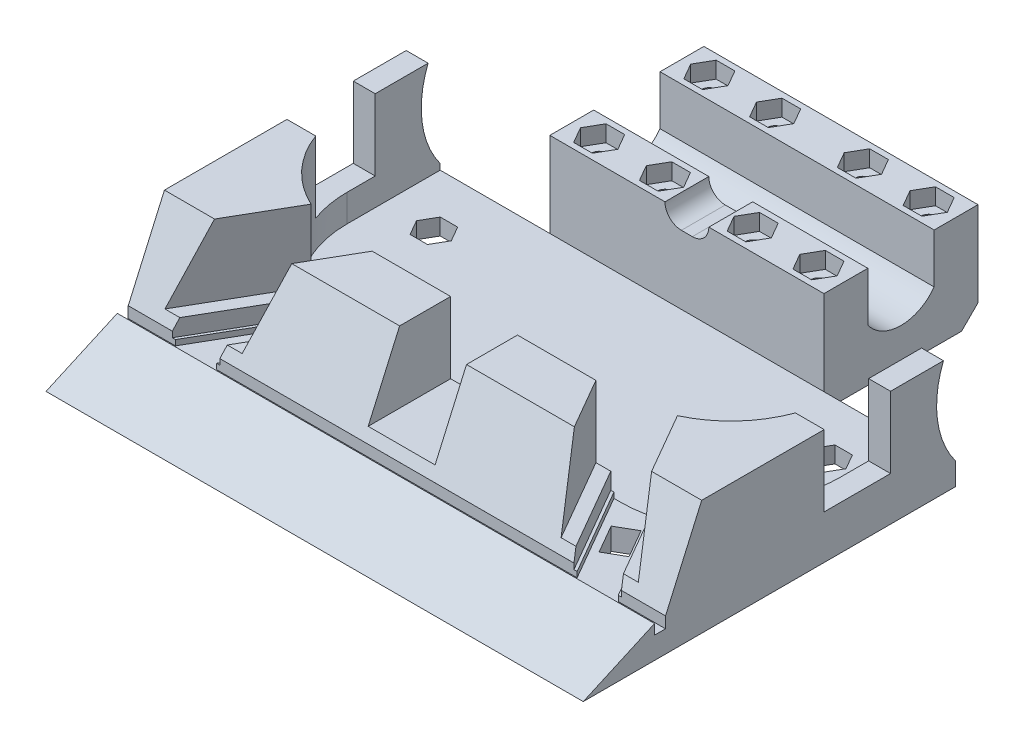
from build123d import *

# Parameters (mm, degrees)
BASE_DEPTH                                           = 3
CROQUIS3_W                                           = 50
CROQUIS3_H                                           = 28.1
MOTORES_DEPTH                                        = 15.5
CORTE_MOTORES_REACH                                  = 92.66
CABLES_MOTORES_REACH                                 = 87.753
REFRENTADO_PARA_TORNILLO_CON_CABEZA_TRON_D           = 2.8
REFRENTADO_PARA_TORNILLO_CON_CABEZA_TRON_DEPTH       = 19.490441672
REFRENTADO_PARA_TORNILLO_CON_CABEZA_TRON_CBORE_D     = 6
REFRENTADO_PARA_TORNILLO_CON_CABEZA_TRON_CBORE_DEPTH = 4
REFRENTADO_PARA_TORNILLO_CON_CABEZA_TRON_TIP         = 0.509558328
TUERCAS_DEPTH                                        = 3
MAT_TUERCAS_COUNT                                    = 2
MAT_TUERCAS_PITCH                                    = 20.1
SOBRESALIENTE_FRENTE_DEPTH                           = 1
CROQUIS17_W                                          = 49
CROQUIS17_H                                          = 13
SOBRESALIENTE_S_PISO_DEPTH                           = 4
CROQUIS18_W                                          = 4
CROQUIS18_H                                          = 11.85
SOPORTE_SENSORES_DEPTH                               = 13
RAMPA_DEPTH                                          = 49
SENSOR_PISO_REACH                                    = 74.409
CHAFL_N1_SIZE                                        = 3
CORTAR_EXTRUIR2_START                                = 1
CORTAR_EXTRUIR2_DEPTH                                = 3
CORTAR_EXTRUIR3_DEPTH                                = 10
CORTAR_EXTRUIR5_REACH                                = 74.409
ELIMINAR_START                                       = 33
ELIMINAR_CARA3_DEPTH                                 = 10
ELIMINAR_START_2                                     = -43
ELIMINAR_CARA4_DEPTH                                 = 10


# Read off the part's stored shape, not the designer's step: Eliminar cara3, Eliminar cara4
with BuildPart() as part:
    # Croquis2 → BASE (new body)
    with BuildSketch(Plane(origin=(0, 0, 0), x_dir=(1, 0, 0), z_dir=(0, 1, 0))):
        Polygon((-25, 47), (25, 47), (25, 18.9), (49, 18.9), (49, -49), (-49, -49), (-49, 18.9), (-25, 18.9), align=None)
    extrude(amount=BASE_DEPTH)

    # Croquis3 → MOTORES (add)
    with BuildSketch(Plane(origin=(0, 3, 0), x_dir=(1, 0, 0), z_dir=(0, 1, 0))):
        with Locations((0, 32.95)):
            Rectangle(CROQUIS3_W, CROQUIS3_H)
    extrude(amount=MOTORES_DEPTH)

    # Croquis5 → CORTE MOTORES (cut, up to next)
    with BuildSketch(Plane(origin=(25, 0, 0), x_dir=(0, 0, -1), z_dir=(1, 0, 0)), mode=Mode.PRIVATE) as corte_motores_sk1:
        with BuildLine():
            Line((26.9, 18.5), (26.9, 9.5))
            ThreePointArc((26.9, 9.5), (32.95, 6.432550056), (39, 9.5))
            Line((39, 9.5), (39, 18.5))
            Line((39, 18.5), (26.9, 18.5))
        make_face()
    corte_motores_tool1 = extrude(corte_motores_sk1.sketch, amount=-CORTE_MOTORES_REACH, mode=Mode.PRIVATE) & part.part
    add(corte_motores_tool1.solids().sort_by_distance((25, 12.892426, -32.95))[0], mode=Mode.SUBTRACT)

    # Croquis6 → CABLES MOTORES (cut, up to next)
    with BuildSketch(Plane.XY.offset(-18.9), mode=Mode.PRIVATE) as cables_motores_sk1:
        with BuildLine():
            Line((-1, 21.5), (1, 21.5))
            ThreePointArc((1, 21.5), (4, 18.5), (1, 15.5))
            Line((1, 15.5), (-1, 15.5))
            ThreePointArc((-1, 15.5), (-4, 18.5), (-1, 21.5))
        make_face()
    cables_motores_tool1 = extrude(cables_motores_sk1.sketch, amount=-CABLES_MOTORES_REACH, mode=Mode.PRIVATE) & part.part
    add(cables_motores_tool1.solids().sort_by_distance((0, 18.5, -18.9))[0], mode=Mode.SUBTRACT)

    # Refrentado para tornillo con cabeza troncocónica de M32
    with Locations(Plane(origin=(-20, 25.5, -43), x_dir=(0, 0, 1), z_dir=(0, 1, 0))):
        with Locations((0, 0), (20.1, 0), (0, 12), (0, 28), (0, 40), (20.1, 40), (20.1, 28), (20.1, 12)):
            CounterBoreHole(REFRENTADO_PARA_TORNILLO_CON_CABEZA_TRON_D / 2, REFRENTADO_PARA_TORNILLO_CON_CABEZA_TRON_CBORE_D / 2, REFRENTADO_PARA_TORNILLO_CON_CABEZA_TRON_CBORE_DEPTH, depth=REFRENTADO_PARA_TORNILLO_CON_CABEZA_TRON_DEPTH)
            with Locations((0, 0, -(REFRENTADO_PARA_TORNILLO_CON_CABEZA_TRON_DEPTH + REFRENTADO_PARA_TORNILLO_CON_CABEZA_TRON_TIP / 2))):  # 140° drill point
                Cone(0, REFRENTADO_PARA_TORNILLO_CON_CABEZA_TRON_D / 2, REFRENTADO_PARA_TORNILLO_CON_CABEZA_TRON_TIP, mode=Mode.SUBTRACT)

    # Croquis14 → TUERCAS (cut)
    with BuildSketch(Plane(origin=(0, 18.5, 0), x_dir=(1, 0, 0), z_dir=(0, 1, 0))):
        Polygon((21.703183294, 25.85), (18.296816706, 25.85), (16.593633412, 22.9), (18.296816706, 19.95), (21.703183294, 19.95), (23.406366588, 22.9), align=None)
        Polygon((9.703183294, 25.85), (6.296816706, 25.85), (4.593633412, 22.9), (6.296816706, 19.95), (9.703183294, 19.95), (11.406366588, 22.9), align=None)
        Polygon((-6.296816706, 25.85), (-9.703183294, 25.85), (-11.406366588, 22.9), (-9.703183294, 19.95), (-6.296816706, 19.95), (-4.593633412, 22.9), align=None)
        Polygon((-18.296816706, 25.85), (-21.703183294, 25.85), (-23.406366588, 22.9), (-21.703183294, 19.95), (-18.296816706, 19.95), (-16.593633412, 22.9), align=None)
    tuercas = extrude(amount=-TUERCAS_DEPTH, mode=Mode.SUBTRACT)

    # MAT TUERCAS: TUERCAS ×2
    with Locations(*[(0, 0, -i * MAT_TUERCAS_PITCH) for i in range(1, MAT_TUERCAS_COUNT)]):
        add(tuercas, mode=Mode.SUBTRACT)

    # Croquis16 → SOBRESALIENTE FRENTE (add)
    with BuildSketch(Plane(origin=(0, 3, 0), x_dir=(1, 0, 0), z_dir=(0, 1, 0))):
        with BuildLine():
            Line((45, 18.9), (45, 1.9))
            ThreePointArc((45, 1.9), (39.142135624, -12.242135624), (25, -18.1))
            Line((25, -18.1), (-25, -18.1))
            ThreePointArc((-25, -18.1), (-39.142135624, -12.242135624), (-45, 1.9))
            Line((-45, 1.9), (-45, 18.9))
            Line((-45, 18.9), (-49, 18.9))
            Line((-49, 18.9), (-49, -49))
            Line((-49, -49), (49, -49))
            Line((49, -49), (49, 18.9))
            Line((49, 18.9), (45, 18.9))
        make_face()
    extrude(amount=SOBRESALIENTE_FRENTE_DEPTH)

    # Croquis17 → SOBRESALIENTE S PISO (add)
    with BuildSketch(Plane(origin=(0, 4, 0), x_dir=(1, 0, 0), z_dir=(0, 1, 0))):
        with Locations((24.5, -42.5)):
            Rectangle(CROQUIS17_W, CROQUIS17_H)
        Polygon((32.877132403, -34), (23.697263123, -18.1), (0, -18.1), (0, -34), align=None)
        with BuildLine():
            ThreePointArc((45, 1.9), (41.037587476, -10.049719157), (30.720421206, -17.26446663))
            Line((30.720421206, -17.26446663), (40.382685902, -34))
            Line((40.382685902, -34), (49, -34))
            Line((49, -34), (49, 18.9))
            Line((49, 18.9), (45, 18.9))
            Line((45, 18.9), (45, 1.9))
        make_face()
    sobresaliente_s_piso = extrude(amount=SOBRESALIENTE_S_PISO_DEPTH)

    # Croquis18 → SOPORTE SENSORES (add)
    with BuildSketch(Plane(origin=(0, 8, 0), x_dir=(1, 0, 0), z_dir=(0, 1, 0))):
        with Locations((47, 12.975)):
            Rectangle(CROQUIS18_W, CROQUIS18_H)
        with BuildLine():
            Line((49, -34), (49, -5.05))
            Line((49, -5.05), (43.753599654, -5.05))
            ThreePointArc((43.753599654, -5.05), (39.694102096, -11.667732441), (33.420427324, -16.241014406))
            Line((33.420427324, -16.241014406), (43.673582437, -34))
            Line((43.673582437, -34), (49, -34))
        make_face()
        Polygon((20.406366588, -18.1), (6.1, -18.1), (6.1, -34), (29.586235868, -34), align=None)
    soporte_sensores = extrude(amount=SOPORTE_SENSORES_DEPTH)

    # Croquis19 → RAMPA (cut)
    with BuildSketch(Plane(origin=(49, 0, 0), x_dir=(0, 0, -1), z_dir=(1, 0, 0))):
        with BuildLine():
            Line((16.701923191, 21), (18.9, 21))
            Line((18.9, 21), (18.9, 4.066999473))
            ThreePointArc((18.9, 4.066999473), (15.595605994, 12.247222003), (16.701923191, 21))
        make_face()
        Polygon((-24.855192519, 26.763425468), (-49, 26.763425468), (-49, 0), (-35.546964974, 6.037568947), (-33.998497777, 6.037568947), align=None)
    rampa = extrude(amount=-RAMPA_DEPTH, mode=Mode.SUBTRACT)

    # Croquis22 → SENSOR PISO (cut, up to next)
    with BuildSketch(Plane(origin=(0, 0, 0), x_dir=(1, 0, 0), z_dir=(0, 1, 0)), mode=Mode.PRIVATE) as sensor_piso_sk1:
        with BuildLine():
            Line((34, -36), (42, -36))
            ThreePointArc((42, -36), (42.707106781, -36.292893219), (43, -37))
            Line((43, -37), (43, -40))
            ThreePointArc((43, -40), (42.707106781, -40.707106781), (42, -41))
            Line((42, -41), (34, -41))
            ThreePointArc((34, -41), (33.292893219, -40.707106781), (33, -40))
            Line((33, -40), (33, -37))
            ThreePointArc((33, -37), (33.292893219, -36.292893219), (34, -36))
        make_face()
    sensor_piso_tool1 = extrude(sensor_piso_sk1.sketch, amount=SENSOR_PISO_REACH, mode=Mode.PRIVATE) & part.part
    sensor_piso = sensor_piso_tool1.solids().sort_by_distance((38, 0, 38.5))[0]
    add(sensor_piso, mode=Mode.SUBTRACT)

    # Chaflán1
    chafl_n1_edges = [part.edges().sort_by_distance(p)[0] for p in [
        (0, 0, -47),
    ]]
    chamfer(chafl_n1_edges, length=CHAFL_N1_SIZE)

    # Simetría1: SOBRESALIENTE S PISO, SOPORTE SENSORES, RAMPA, SENSOR PISO across plane
    add(sobresaliente_s_piso.mirror(Plane(origin=(0, 0, 0), x_dir=(0, 0, 1), z_dir=(1, 0, 0))))
    add(soporte_sensores.mirror(Plane(origin=(0, 0, 0), x_dir=(0, 0, 1), z_dir=(1, 0, 0))))
    add(rampa.mirror(Plane(origin=(0, 0, 0), x_dir=(0, 0, 1), z_dir=(1, 0, 0))), mode=Mode.SUBTRACT)
    add(sensor_piso.mirror(Plane(origin=(0, 0, 0), x_dir=(0, 0, 1), z_dir=(1, 0, 0))), mode=Mode.SUBTRACT)

    # Croquis24 → Cortar-Extruir2 (cut)
    with BuildSketch(Plane(origin=(0, 4, 0), x_dir=(1, 0, 0), z_dir=(0, 1, 0)).offset(CORTAR_EXTRUIR2_START)):
        Polygon((21.901787405, -15.990144834), (32.299782134, -34), (40.960036171, -34), (30.562041443, -15.990144834), align=None)
    cortar_extruir2 = extrude(amount=CORTAR_EXTRUIR2_DEPTH, mode=Mode.SUBTRACT)

    # Croquis25 → Cortar-Extruir3 (cut)
    with BuildSketch(Plane(origin=(0, 0, 0), x_dir=(1, 0, 0), z_dir=(0, 1, 0))):
        Polygon((30.814492879, -27.927403547), (27.814492879, -22.731251124), (31.278594494, -20.731251124), (34.278594494, -25.927403547), align=None)
    cortar_extruir3 = extrude(amount=CORTAR_EXTRUIR3_DEPTH, mode=Mode.SUBTRACT)

    # Croquis28 → Cortar-Extruir5 (cut, up to next)
    with BuildSketch(Plane(origin=(0, 0, 0), x_dir=(1, 0, 0), z_dir=(0, 1, 0)), mode=Mode.PRIVATE) as cortar_extruir5_sk1:
        Polygon((37.58771324, 11.5), (34.41228676, 11.5), (32.824573519, 8.75), (34.41228676, 6), (37.58771324, 6), (39.175426481, 8.75), align=None)
    cortar_extruir5_tool1 = extrude(cortar_extruir5_sk1.sketch, amount=CORTAR_EXTRUIR5_REACH, mode=Mode.PRIVATE) & part.part
    cortar_extruir5 = cortar_extruir5_tool1.solids().sort_by_distance((36, 0, -8.75))[0]
    add(cortar_extruir5, mode=Mode.SUBTRACT)

    # Eliminar cara3 outline → Eliminar cara3 (add)
    with BuildSketch(Plane.YZ.offset(ELIMINAR_START)):
        Polygon((3.590308914, 41), (0, 41), (0, 36), (5.834251985, 36), align=None)
    extrude(amount=ELIMINAR_CARA3_DEPTH)

    # Simetría3: Cortar-Extruir2, Cortar-Extruir3, Cortar-Extruir5 across plane
    add(cortar_extruir2.mirror(Plane(origin=(0, 0, 0), x_dir=(0, 0, 1), z_dir=(1, 0, 0))), mode=Mode.SUBTRACT)
    add(cortar_extruir3.mirror(Plane(origin=(0, 0, 0), x_dir=(0, 0, 1), z_dir=(1, 0, 0))), mode=Mode.SUBTRACT)
    add(cortar_extruir5.mirror(Plane(origin=(0, 0, 0), x_dir=(0, 0, 1), z_dir=(1, 0, 0))), mode=Mode.SUBTRACT)

    # Eliminar cara4 outline → Eliminar cara4 (add)
    with BuildSketch(Plane.YZ.offset(ELIMINAR_START_2)):
        Polygon((3.590308914, 41), (0, 41), (0, 36), (5.834251985, 36), align=None)
    extrude(amount=ELIMINAR_CARA4_DEPTH)


solid = part.part
